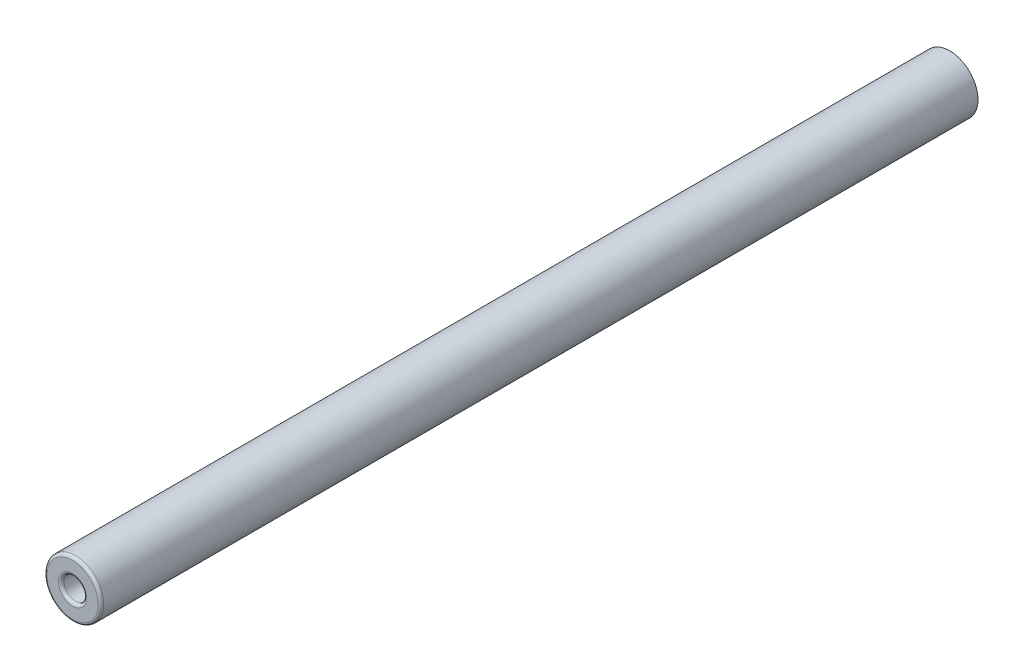
from build123d import *

# Parameters (mm, degrees)
CROQUIS1_R              = 2.5
SALIENTE_EXTRUIR1_DEPTH = 77.5
CROQUIS2_R              = 1
CORTAR_EXTRUIR1_DEPTH   = 10
REDONDEO1_R             = 0.25


with BuildPart() as part:
    # Croquis1 → Saliente-Extruir1 (new body)
    with BuildSketch(Plane.XY):
        Circle(CROQUIS1_R)
    extrude(amount=SALIENTE_EXTRUIR1_DEPTH)

    # Croquis2 → Cortar-Extruir1 (cut)
    with BuildSketch(Plane.XY.offset(77.5)):
        Circle(CROQUIS2_R)
    extrude(amount=-CORTAR_EXTRUIR1_DEPTH, mode=Mode.SUBTRACT)

    # Redondeo1
    redondeo1_edges = [part.edges().sort_by_distance(p)[0] for p in [
        (-2.5, 0, 77.5),
        (-1, 0, 77.5),
    ]]
    fillet(redondeo1_edges, radius=REDONDEO1_R)


solid = part.part
